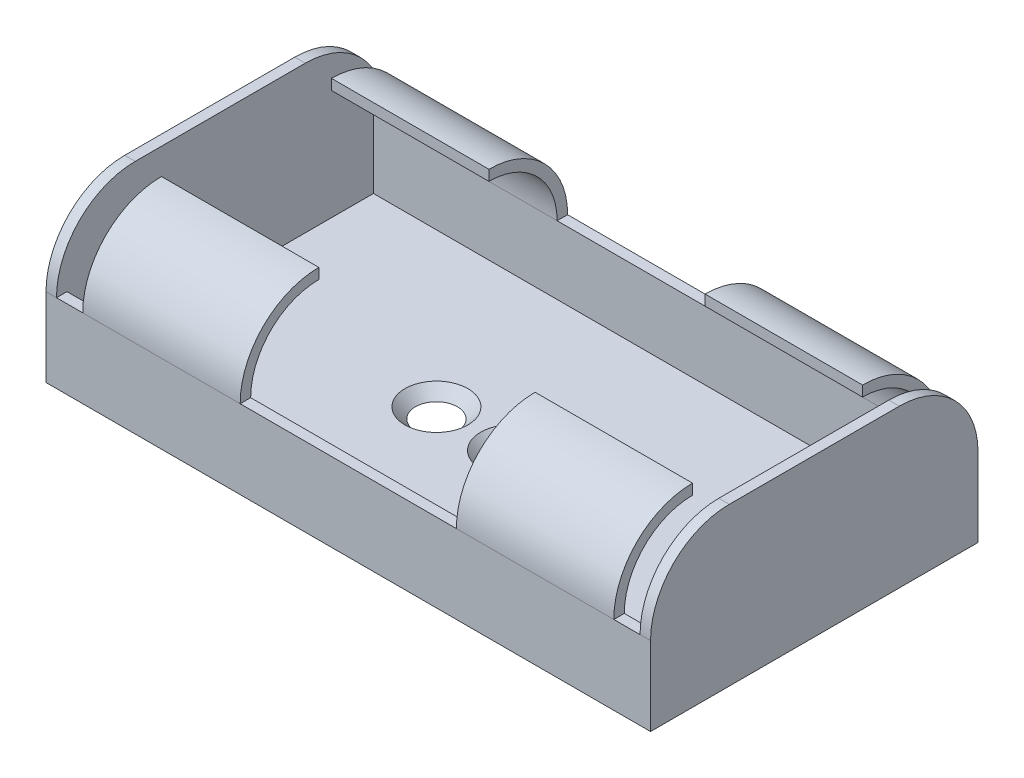
from build123d import *

# Parameters (mm, degrees)
SKETCH1_W                   = 57.6
SKETCH1_H                   = 31.2
BOSS_EXTRUDE1_DEPTH         = 15
FILLET1_R                   = 7.5
SHELL1_START                = -27.8
SHELL1_DEPTH                = 55.6
SKETCH4_W                   = 2.5
SKETCH4_H                   = 7.5
SKETCH4_W_2                 = 20.6
CUT_EXTRUDE1_DEPTH          = 46.03198863
SKETCH5_R                   = 1.4
CUT_EXTRUDE2_DEPTH          = 15
M3_TAPPED_HOLE1_D           = 2.5
M3_TAPPED_HOLE1_DEPTH       = 16
M3_TAPPED_HOLE1_CSINK_D     = 6
M3_TAPPED_HOLE1_CSINK_ANGLE = 90
M3_TAPPED_HOLE1_TIP         = 0.751075774


# Read off the part's stored shape, not the designer's step: Shell1
with BuildPart() as part:
    # Sketch1 → Boss-Extrude1 (new body)
    with BuildSketch(Plane(origin=(0, 0, 0), x_dir=(1, 0, 0), z_dir=(0, 1, 0))):
        Rectangle(SKETCH1_W, SKETCH1_H)
    extrude(amount=BOSS_EXTRUDE1_DEPTH)

    # Fillet1
    fillet1_edges = [part.edges().sort_by_distance(p)[0] for p in [
        (0, 15, 15.6),
        (0, 15, -15.6),
    ]]
    fillet(fillet1_edges, radius=FILLET1_R)

    # Shell1 outline → Shell1 (cut)
    with BuildSketch(Plane.YZ.offset(SHELL1_START)):
        with BuildLine():
            Line((15, -8.1), (15, 8.1))
            Line((15, 8.1), (14, 8.1))
            ThreePointArc((14, 8.1), (12.096194078, 12.696194078), (7.5, 14.6))
            Line((7.5, 14.6), (1, 14.6))
            Line((1, 14.6), (1, -14.6))
            Line((1, -14.6), (7.5, -14.6))
            ThreePointArc((7.5, -14.6), (12.096194078, -12.696194078), (14, -8.1))
            Line((14, -8.1), (15, -8.1))
        make_face()
    extrude(amount=SHELL1_DEPTH, mode=Mode.SUBTRACT)

    # Sketch4 → Cut-Extrude1 (cut, through all)
    with BuildSketch(Plane.XY.offset(15.6)):
        with Locations((-26.55, 11.25)):
            Rectangle(SKETCH4_W, SKETCH4_H)
        with Locations((0, 11.25)):
            Rectangle(SKETCH4_W_2, SKETCH4_H)
        with Locations((26.55, 11.25)):
            Rectangle(SKETCH4_W, SKETCH4_H)
    extrude(amount=-CUT_EXTRUDE1_DEPTH, mode=Mode.SUBTRACT)

    # Sketch5 → Cut-Extrude2 (cut)
    with BuildSketch(Plane(origin=(0, 1, 0), x_dir=(1, 0, 0), z_dir=(0, 1, 0))):
        with Locations(Location((0, 0, 0), (0, 0, 270))):
            Circle(SKETCH5_R)
        with Locations(Location((7.2, 0, 0), (0, 0, 270))):
            Circle(SKETCH5_R)
        with Locations(Location((-7.2, 0, 0), (0, 0, 270))):
            Circle(SKETCH5_R)
    extrude(amount=-CUT_EXTRUDE2_DEPTH, mode=Mode.SUBTRACT)

    # M3 Tapped Hole1
    with Locations(Plane(origin=(0, 1, 31.4), x_dir=(1, 0, 0), z_dir=(0, 1, 0))):
        with Locations((7.2, 31.4), (0, 31.4), (-7.2, 31.4)):
            CounterSinkHole(M3_TAPPED_HOLE1_D / 2, M3_TAPPED_HOLE1_CSINK_D / 2, depth=M3_TAPPED_HOLE1_DEPTH, counter_sink_angle=M3_TAPPED_HOLE1_CSINK_ANGLE)
            with Locations((0, 0, -(M3_TAPPED_HOLE1_DEPTH + M3_TAPPED_HOLE1_TIP / 2))):  # 118° drill point
                Cone(0, M3_TAPPED_HOLE1_D / 2, M3_TAPPED_HOLE1_TIP, mode=Mode.SUBTRACT)


solid = part.part
